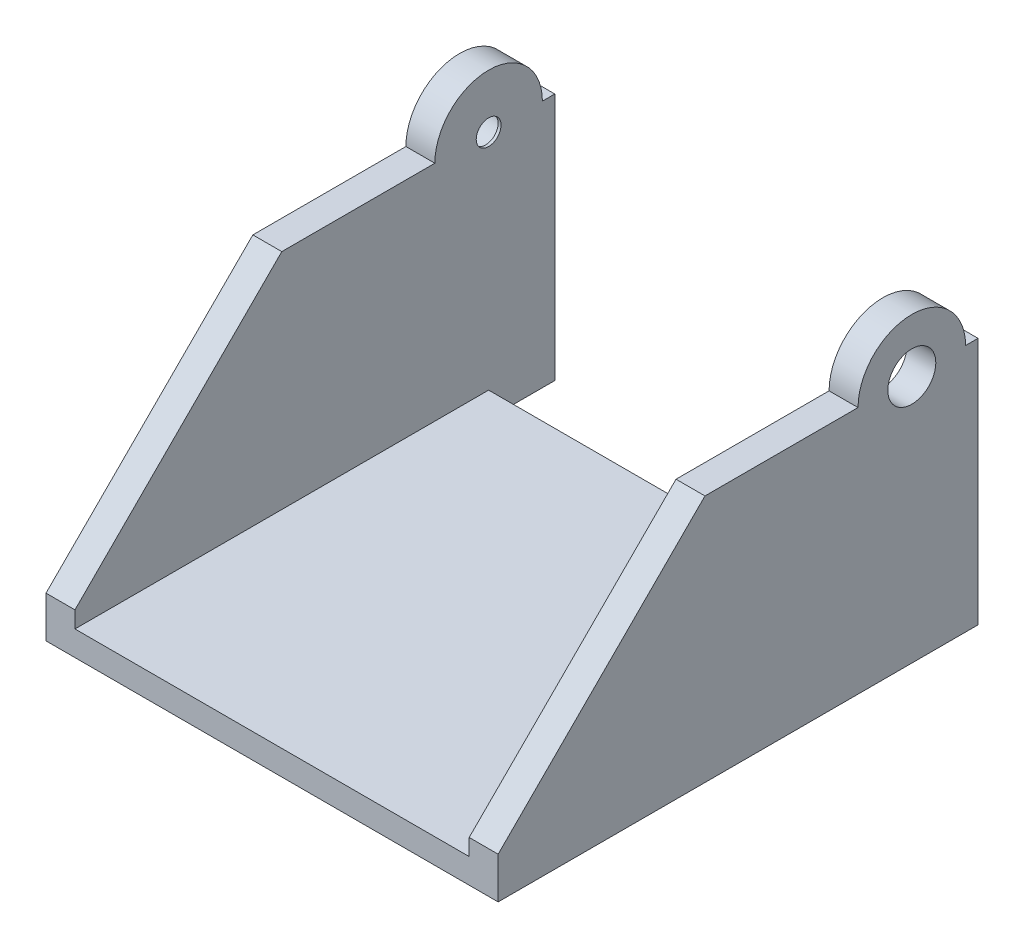
from build123d import *
from build123d.topology import SkipClean

# Parameters (mm, degrees)
BOSS_EXTRUDE1_DEPTH     = 50
BOSS_EXTRUDE2_DEPTH     = 3.5
SKETCH3_R               = 1.5
CUT_EXTRUDE1_DEPTH      = 65.394531018
CUT_EXTRUDE2_DEPTH      = 80.916346888
CUT_EXTRUDE2_DEPTH_BACK = 3.15
SKETCH4_R               = 2.5
SKETCH5_R               = 2.9
CUT_EXTRUDE3_DEPTH      = 7.15
CUT_EXTRUDE4_DEPTH      = 7.15


with BuildPart() as part:
    # Sketch1 → Boss-Extrude1 (new body)
    with BuildSketch(Plane.XY):
        Polygon((-23.825, -27), (-23.825, 0), (-27.325, 0), (-27.325, -30), (0, -30), (0, -27), align=None)
    boss_extrude1 = extrude(amount=BOSS_EXTRUDE1_DEPTH)

    # Sketch2 → Boss-Extrude2 (add)
    with BuildSketch(Plane(origin=(-23.825, 0, 0), x_dir=(0, 0, -1), z_dir=(1, 0, 0))):
        with BuildLine():
            ThreePointArc((-1.5, 0), (1.060660172, 1.060660172), (0, -1.5))
            Line((0, -1.5), (0, -30))
            Line((0, -30), (8, -30))
            Line((8, -30), (8, 0))
            Line((8, 0), (6.5, 0))
            ThreePointArc((6.5, 0), (0, 6.5), (-6.5, 0))
            Line((-6.5, 0), (-1.5, 0))
        make_face()
    boss_extrude2 = extrude(amount=-BOSS_EXTRUDE2_DEPTH)

    # Sketch3 → Cut-Extrude1 (cut, symmetric)
    with BuildSketch(Plane.ZY.offset(27.325)):
        Circle(SKETCH3_R)
    cut_extrude1 = extrude(amount=CUT_EXTRUDE1_DEPTH, both=True, mode=Mode.SUBTRACT)

    # Mirror1: Boss-Extrude1, Boss-Extrude2, Cut-Extrude1 across plane
    with SkipClean():  # the faces are left unmerged after this step: merging them gives an invalid solid
        add(boss_extrude1.mirror(Plane(origin=(0, 0, 50), x_dir=(0, 0, 1), z_dir=(-1, 0, 0))))
        add(boss_extrude2.mirror(Plane(origin=(0, 0, 50), x_dir=(0, 0, 1), z_dir=(-1, 0, 0))))
        add(cut_extrude1.mirror(Plane(origin=(0, 0, 50), x_dir=(0, 0, 1), z_dir=(-1, 0, 0))), mode=Mode.SUBTRACT)

    # Sketch4 → Cut-Extrude2 (cut, two sides: drawn at the far end of the back side and taken through both)
    with SkipClean():  # the faces are left unmerged after this step: merging them gives an invalid solid
        with BuildSketch(Plane.ZY.offset(27.325).offset(-CUT_EXTRUDE2_DEPTH_BACK)):
            Circle(SKETCH4_R)
        extrude(amount=CUT_EXTRUDE2_DEPTH + CUT_EXTRUDE2_DEPTH_BACK, mode=Mode.SUBTRACT)

    # Sketch5 → Cut-Extrude3 (cut)
    with BuildSketch(Plane(origin=(27.325, 0, 0), x_dir=(0, 0, -1), z_dir=(1, 0, 0))):
        Circle(SKETCH5_R)
    extrude(amount=-CUT_EXTRUDE3_DEPTH, mode=Mode.SUBTRACT)

    # Sketch6 → Cut-Extrude4 (cut)
    with BuildSketch(Plane.ZY.offset(27.325)):
        Polygon((50, -25), (50, 0), (25, 0), align=None)
    cut_extrude4 = extrude(amount=-CUT_EXTRUDE4_DEPTH, mode=Mode.SUBTRACT)

    # Mirror2: Cut-Extrude4 across plane
    add(cut_extrude4.mirror(Plane(origin=(0, 0, 0), x_dir=(0, 0, 1), z_dir=(1, 0, 0))), mode=Mode.SUBTRACT)


solid = part.part
